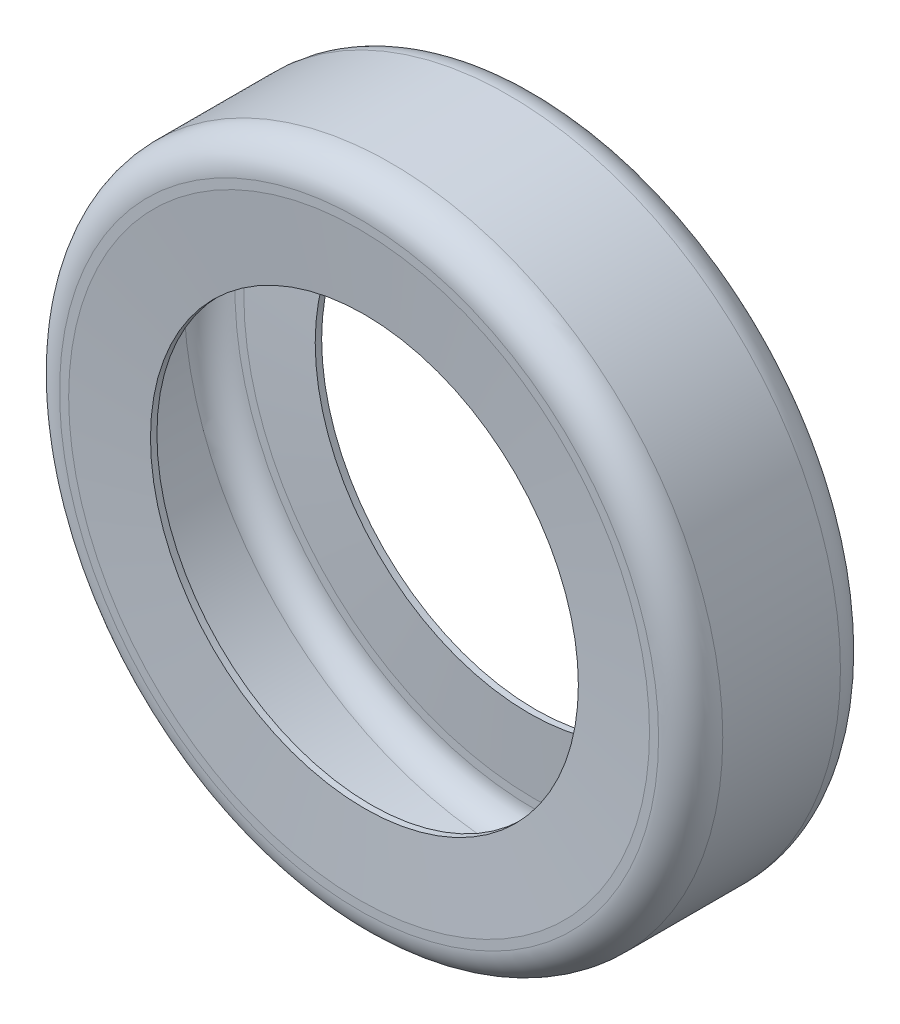
from build123d import *

# Parameters (mm, degrees)
SKETCH_1_R          = 175
SKETCH_1_R_2        = 100
EXTRUDE_1_DEPTH     = 85
CHAMFER_1_SIZE      = 2.5
CHAMFER_1_SIZE2     = 35.751665642
CHAMFER_2_SIZE      = 2.5
CHAMFER_2_SIZE2     = 35.751665642
FILLET_1_R          = 20
SKETCH_4_R          = 243.967557574
SKETCH_4_R_2        = 155
CUT_EXTRUDE_3_DEPTH = 156
FILLET_2_R          = 15


# Read off the part's stored shape, not the designer's step: 抽壳2
with BuildPart() as part:
    # 草图1 → 凸台-拉伸1 (new body)
    with BuildSketch(Plane.XY):
        Circle(SKETCH_1_R)
        Circle(SKETCH_1_R_2, mode=Mode.SUBTRACT)
    extrude(amount=EXTRUDE_1_DEPTH)

    # 倒角1
    chamfer_1_edges = [part.edges().sort_by_distance(p)[0] for p in [
        (-100, 0, 85),
    ]]
    chamfer_1_side = [part.faces().sort_by_distance(p)[0] for p in [
        (-100, 0, 42.5),
    ]]
    chamfer(chamfer_1_edges, length=CHAMFER_1_SIZE, length2=CHAMFER_1_SIZE2, reference=chamfer_1_side[0])

    # 倒角2
    chamfer_2_edges = [part.edges().sort_by_distance(p)[0] for p in [
        (-100, 0, 0),
    ]]
    chamfer_2_side = [part.faces().sort_by_distance(p)[0] for p in [
        (-100, 0, 41.25),
    ]]
    chamfer(chamfer_2_edges, length=CHAMFER_2_SIZE, length2=CHAMFER_2_SIZE2, reference=chamfer_2_side[0])

    # 圆角1
    fillet_1_edges = [part.edges().sort_by_distance(p)[0] for p in [
        (-175, 0, 0),
        (-175, 0, 85),
    ]]
    fillet(fillet_1_edges, radius=FILLET_1_R)

    # 草图4 → 切除-拉伸3 (cut)
    with BuildSketch(Plane(origin=(0, 0, 0), x_dir=(-1, 0, 0), z_dir=(0, 0, -1))):
        Circle(SKETCH_4_R)
        Circle(SKETCH_4_R_2, mode=Mode.SUBTRACT)
    extrude(amount=-CUT_EXTRUDE_3_DEPTH, mode=Mode.SUBTRACT)

    # 圆角2
    fillet_2_edges = [part.edges().sort_by_distance(p)[0] for p in [
        (155, 0, 85),
        (155, 0, 0),
    ]]
    fillet(fillet_2_edges, radius=FILLET_2_R)

    # 抽壳2 outline → 抽壳2 (revolve, cut)
    with BuildSketch(Plane.XZ):
        with BuildLine():
            Line((140, 82), (135.85642795, 82))
            Line((135.85642795, 82), (100, 79.492674306))
            Line((100, 79.492674306), (100, 5.507325694))
            Line((100, 5.507325694), (135.85642795, 3))
            Line((135.85642795, 3), (140, 3))
            ThreePointArc((140, 3), (148.485281374, 6.514718626), (152, 15))
            Line((152, 15), (152, 70))
            ThreePointArc((152, 70), (148.485281374, 78.485281374), (140, 82))
        make_face()
    revolve(axis=Axis((0, 0, 0), (0, 0, 1)), mode=Mode.SUBTRACT)


solid = part.part
